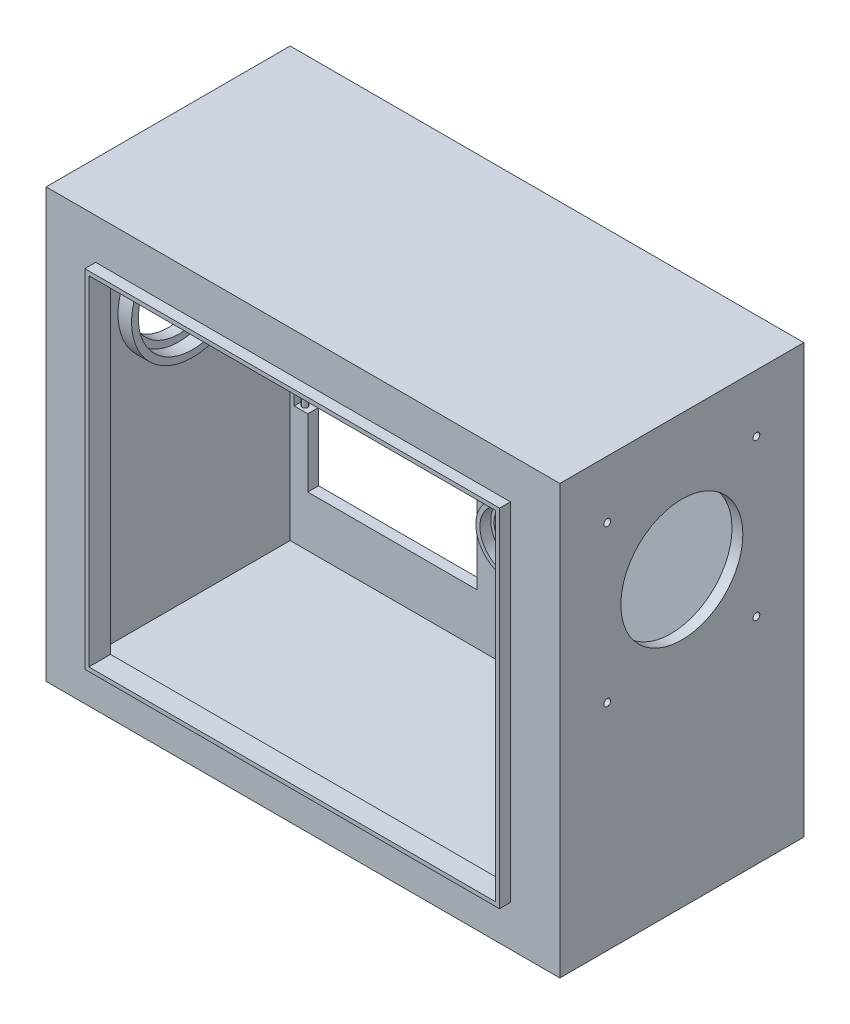
from build123d import *

# Parameters (mm, degrees)
CROQUIS1_W               = 379
CROQUIS1_H               = 316
SALIENTE_EXTRUIR1_DEPTH  = 180
VACIADO1_T               = -8
CROQUIS2_R               = 35
CORTAR_EXTRUIR4_DEPTH    = 20
CROQUIS4_R               = 45
CROQUIS4_R_2             = 40
SALIENTE_EXTRUIR4_DEPTH  = 10
CORTAR_EXTRUIR6_START    = -10
CROQUIS6_R               = 45
CORTAR_EXTRUIR6_DEPTH    = 10
CROQUIS7_R               = 24
CROQUIS7_R_2             = 21
SALIENTE_EXTRUIR9_DEPTH  = 18
CROQUIS11_W              = 363
CROQUIS11_H              = 300
CROQUIS11_W_2            = 300
CROQUIS11_H_2            = 250
SALIENTE_EXTRUIR10_DEPTH = 8
CROQUIS12_W              = 306
CROQUIS12_H              = 256
CROQUIS12_W_2            = 300
CROQUIS12_H_2            = 250
SALIENTE_EXTRUIR11_DEPTH = 8
CROQUIS20_R              = 21
CROQUIS20_R_2            = 18.5
SALIENTE_EXTRUIR19_DEPTH = 10
TALADRO_ROSCADO_M63_D    = 5
CROQUIS28_W              = 125
CROQUIS28_H              = 225
CORTAR_EXTRUIR7_DEPTH    = 8
CROQUIS29_W              = 10
CROQUIS29_H              = 20
CORTAR_EXTRUIR9_DEPTH    = 8
CROQUIS30_R              = 2
SALIENTE_EXTRUIR20_DEPTH = 9
CROQUIS31_R              = 2
SALIENTE_EXTRUIR21_DEPTH = 9


with BuildPart() as part:
    # Croquis1 → Saliente-Extruir1 (new body)
    with BuildSketch(Plane.XY):
        Rectangle(CROQUIS1_W, CROQUIS1_H)
    extrude(amount=SALIENTE_EXTRUIR1_DEPTH)

    # Vaciado1
    vaciado1_openings = [part.faces().sort_by_distance(p)[0] for p in [
        (0, 0, 180),
    ]]
    offset(amount=VACIADO1_T, openings=vaciado1_openings, kind=Kind.INTERSECTION)

    # Croquis2 → Cortar-Extruir4 (cut)
    with BuildSketch(Plane.ZY.offset(189.5)):
        with Locations((90, 58)):
            Circle(CROQUIS2_R)
    extrude(amount=-CORTAR_EXTRUIR4_DEPTH, mode=Mode.SUBTRACT)

    # Croquis4 → Saliente-Extruir4 (add)
    with BuildSketch(Plane(origin=(-181.5, 0, 0), x_dir=(0, 0, -1), z_dir=(1, 0, 0))):
        with Locations((-90, 58)):
            Circle(CROQUIS4_R)
        with Locations((-90, 58)):
            Circle(CROQUIS4_R_2, mode=Mode.SUBTRACT)
    extrude(amount=SALIENTE_EXTRUIR4_DEPTH)

    # Croquis6 → Cortar-Extruir6 (cut)
    with BuildSketch(Plane(origin=(189.5, 0, 0), x_dir=(0, 0, -1), z_dir=(1, 0, 0)).offset(CORTAR_EXTRUIR6_START)):
        with Locations((-90, 58)):
            Circle(CROQUIS6_R)
    extrude(amount=CORTAR_EXTRUIR6_DEPTH, mode=Mode.SUBTRACT)

    # Croquis7 → Saliente-Extruir9 (add)
    with BuildSketch(Plane.XY.offset(8)):
        with Locations((-2.5, -53)):
            Circle(CROQUIS7_R)
        with Locations((-2.5, -53)):
            Circle(CROQUIS7_R_2, mode=Mode.SUBTRACT)
    extrude(amount=SALIENTE_EXTRUIR9_DEPTH)

    # Croquis11 → Saliente-Extruir10 (add)
    with BuildSketch(Plane.XY.offset(180)):
        Rectangle(CROQUIS11_W, CROQUIS11_H)
        Rectangle(CROQUIS11_W_2, CROQUIS11_H_2, mode=Mode.SUBTRACT)
    extrude(amount=-SALIENTE_EXTRUIR10_DEPTH)

    # Croquis12 → Saliente-Extruir11 (add)
    with BuildSketch(Plane.XY.offset(180)):
        Rectangle(CROQUIS12_W, CROQUIS12_H)
        Rectangle(CROQUIS12_W_2, CROQUIS12_H_2, mode=Mode.SUBTRACT)
    extrude(amount=SALIENTE_EXTRUIR11_DEPTH)

    # Croquis20 → Saliente-Extruir19 (add)
    with BuildSketch(Plane.XY.offset(8)):
        with Locations((-2.5, -53)):
            Circle(CROQUIS20_R)
        with Locations((-2.5, -53)):
            Circle(CROQUIS20_R_2, mode=Mode.SUBTRACT)
    extrude(amount=SALIENTE_EXTRUIR19_DEPTH)

    # Taladro roscado M63 (through all)
    with Locations(Plane(origin=(-189.5, 115.5, 35), x_dir=(0, 0, -1), z_dir=(-1, 0, 0))):
        with Locations((0, 0), (-110, 0), (-110, 115), (0, 115)):
            Hole(TALADRO_ROSCADO_M63_D / 2)

    # Croquis28 → Cortar-Extruir7 (cut)
    with BuildSketch(Plane(origin=(0, 0, 0), x_dir=(-1, 0, 0), z_dir=(0, 0, -1))):
        with Locations((106, 0)):
            Rectangle(CROQUIS28_W, CROQUIS28_H)
    extrude(amount=-CORTAR_EXTRUIR7_DEPTH, mode=Mode.SUBTRACT)

    # Croquis29 → Cortar-Extruir9 (cut)
    with BuildSketch(Plane(origin=(0, 0, 0), x_dir=(-1, 0, 0), z_dir=(0, 0, -1))):
        with Locations((173.5, 52.5)):
            Rectangle(CROQUIS29_W, CROQUIS29_H)
        with Locations((173.5, -52.5)):
            Rectangle(CROQUIS29_W, CROQUIS29_H)
    extrude(amount=-CORTAR_EXTRUIR9_DEPTH, mode=Mode.SUBTRACT)

    # Croquis30 → Saliente-Extruir20 (add)
    with BuildSketch(Plane(origin=(0, 42.5, 0), x_dir=(1, 0, 0), z_dir=(0, 1, 0))):
        with Locations((-174.5, -4)):
            Circle(CROQUIS30_R)
    extrude(amount=SALIENTE_EXTRUIR20_DEPTH)

    # Croquis31 → Saliente-Extruir21 (add)
    with BuildSketch(Plane(origin=(0, -62.5, 0), x_dir=(1, 0, 0), z_dir=(0, 1, 0))):
        with Locations((-174.5, -4)):
            Circle(CROQUIS31_R)
    extrude(amount=SALIENTE_EXTRUIR21_DEPTH)


solid = part.part
